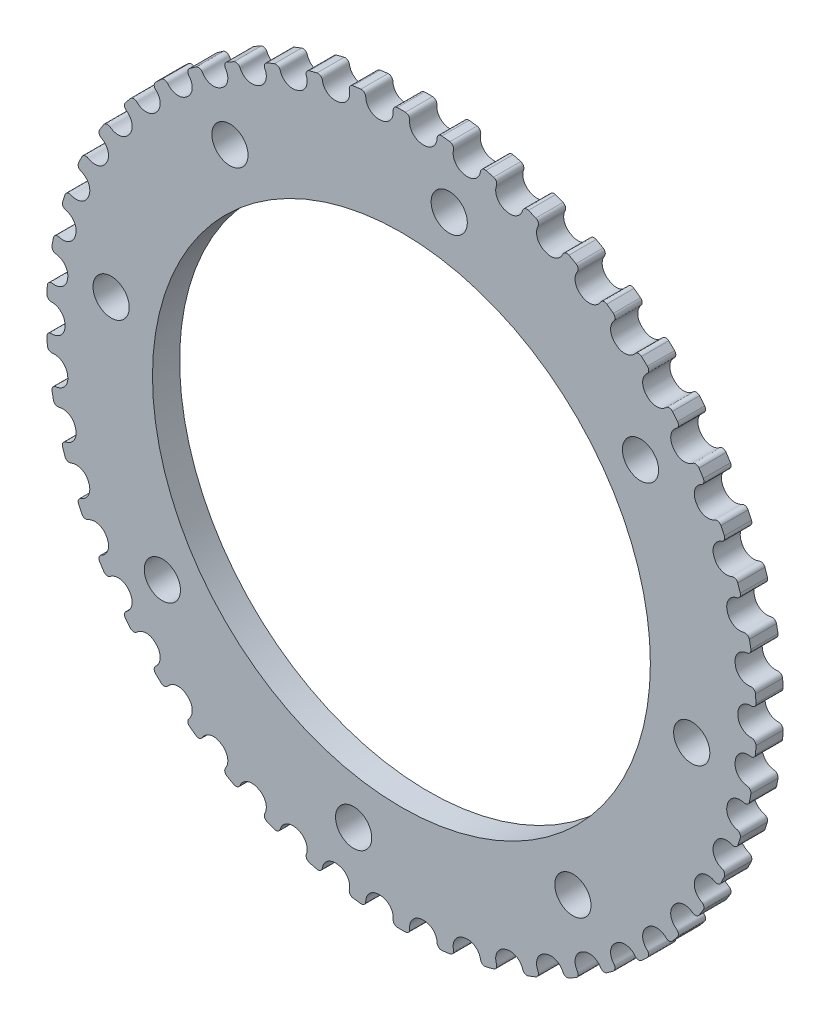
from build123d import *

# Parameters (mm, degrees)
SKETCHREVOLVEGEARBELT01_W       = 3
SKETCHREVOLVEGEARBELT01_H       = 39.217218411
TOOTHEXTRUDECUTGEARBELT01_DEPTH = 7.238999891
PATTERNGEARBELT01_COUNT         = 50
BOREREVOLVESKETCH_W             = 14.477999782
BOREREVOLVESKETCH_H             = 27.5
SKETCH1_R                       = 2
CUT_EXTRUDE1_DEPTH              = 10


with BuildPart() as part:
    # SketchRevolveGearBelt01 → GearBelt01 (revolve)
    with BuildSketch(Plane(origin=(0, 0, 0), x_dir=(0, 0, -1), z_dir=(1, 0, 0))):
        with Locations((0, 19.608609206)):
            Rectangle(SKETCHREVOLVEGEARBELT01_W, SKETCHREVOLVEGEARBELT01_H)
    revolve(axis=Axis((0, 0, 0), (0, 0, -1)))

    # SketchToothGearBelt01 → ToothExtrudeCutGearBelt01 (cut, symmetric)
    with BuildSketch(Plane.XY):
        with BuildLine():
            ThreePointArc((39.164679022, 2.032334243), (39.217374535, 0), (39.164679022, -2.032334243))
            add(Edge.make_bspline(
                [(39.164679022, -2.032334243), (39.166048883, -2.005984565), (39.164883295, -1.966294001), (39.156943231, -1.91408071), (39.147835553, -1.875531869), (39.135634795, -1.83784758), (39.12042125, -1.801275572), (39.102294908, -1.766056265), (39.081374934, -1.732421187), (39.057798852, -1.700591449), (39.031721649, -1.670776298), (39.003314752, -1.64317173), (38.972764904, -1.617959231), (38.940272938, -1.59530448), (38.906052449, -1.575356646), (38.870328405, -1.558245974), (38.833335623, -1.544088262), (38.795317397, -1.532964211), (38.756523252, -1.524993116), (38.717209712, -1.520055082), (38.66580266, -1.5184582), (38.589994052, -1.519756698), (38.489697952, -1.516042965), (38.377509936, -1.502613699), (38.266707897, -1.480535762), (38.157982142, -1.449806634), (38.052000418, -1.410652745), (37.949416183, -1.363305357), (37.850861265, -1.308058822), (37.756942857, -1.245252774), (37.668239537, -1.175274325), (37.585297771, -1.098554529), (37.50862852, -1.015566038), (37.43870413, -0.926820101), (37.375955295, -0.832863447), (37.320768875, -0.73427489), (37.27348376, -0.631661826), (37.234395318, -0.525656278), (37.203729181, -0.416911781), (37.181730901, -0.306096466), (37.168324647, -0.193899714), (37.165224472, -0.105119728), (37.165512565, -0.040500395), (37.16545238, 0), (37.165512565, 0.040500395), (37.165224472, 0.105119728), (37.168324647, 0.193899714), (37.181730901, 0.306096466), (37.203729181, 0.416911781), (37.234395318, 0.525656278), (37.27348376, 0.631661826), (37.320768875, 0.73427489), (37.375955295, 0.832863447), (37.43870413, 0.926820101), (37.50862852, 1.015566038), (37.585297771, 1.098554529), (37.668239537, 1.175274325), (37.756942857, 1.245252774), (37.850861265, 1.308058822), (37.949416183, 1.363305357), (38.052000418, 1.410652745), (38.157982142, 1.449806634), (38.266707897, 1.480535762), (38.377509936, 1.502613699), (38.489697952, 1.516042965), (38.589994052, 1.519756698), (38.66580266, 1.5184582), (38.717209712, 1.520055082), (38.756523252, 1.524993116), (38.795317397, 1.532964211), (38.833335623, 1.544088262), (38.870328405, 1.558245974), (38.906052449, 1.575356646), (38.940272938, 1.59530448), (38.972764904, 1.617959231), (39.003314752, 1.64317173), (39.031721649, 1.670776298), (39.057798852, 1.700591449), (39.081374934, 1.732421187), (39.102294908, 1.766056265), (39.12042125, 1.801275572), (39.135634795, 1.83784758), (39.147835553, 1.875531869), (39.156943231, 1.91408071), (39.164883295, 1.966294001), (39.166048883, 2.005984565), (39.164679022, 2.032334243)],
                knots=[0, 0, 0, 0, 0.012346399, 0.018519598, 0.024692797, 0.030865997, 0.037039196, 0.043212395, 0.049385595, 0.055558794, 0.061731993, 0.067905193, 0.074078392, 0.080251591, 0.086424791, 0.09259799, 0.09877119, 0.104944389, 0.111117588, 0.117290788, 0.123463987, 0.135171051, 0.152780618, 0.170390185, 0.187999752, 0.205609319, 0.223218886, 0.240828453, 0.25843802, 0.276047587, 0.293657154, 0.311266721, 0.328876288, 0.346485855, 0.364095422, 0.381704989, 0.399314555, 0.416924122, 0.434533689, 0.452143256, 0.469752823, 0.48736239, 0.493681195, 0.5, 0.506318805, 0.51263761, 0.530247177, 0.547856744, 0.565466311, 0.583075878, 0.600685445, 0.618295011, 0.635904578, 0.653514145, 0.671123712, 0.688733279, 0.706342846, 0.723952413, 0.74156198, 0.759171547, 0.776781114, 0.794390681, 0.812000248, 0.829609815, 0.847219382, 0.864828949, 0.876536013, 0.882709212, 0.888882412, 0.895055611, 0.90122881, 0.90740201, 0.913575209, 0.919748409, 0.925921608, 0.932094807, 0.938268007, 0.944441206, 0.950614405, 0.956787605, 0.962960804, 0.969134003, 0.975307203, 0.981480402, 0.987653601, 1, 1, 1, 1], degree=3))
        make_face()
    toothextrudecutgearbelt01 = extrude(amount=TOOTHEXTRUDECUTGEARBELT01_DEPTH, both=True, mode=Mode.SUBTRACT)

    # PatternGearBelt01: ToothExtrudeCutGearBelt01 ×50 about axis
    patterngearbelt01_axis = Axis((0, 0, 55), (0, 0, -1))
    for i in range(1, PATTERNGEARBELT01_COUNT):
        add(toothextrudecutgearbelt01.rotate(patterngearbelt01_axis, i * 360 / PATTERNGEARBELT01_COUNT), mode=Mode.SUBTRACT)

    # BoreRevolveSketch → BoreRevolveCut (revolve, cut)
    with BuildSketch(Plane(origin=(0, 0, 0), x_dir=(0, 0, -1), z_dir=(1, 0, 0))):
        with Locations((0, 13.75)):
            Rectangle(BOREREVOLVESKETCH_W, BOREREVOLVESKETCH_H)
    revolve(axis=Axis((0, 0, 0), (0, 0, -1)), mode=Mode.SUBTRACT)

    # Sketch1 → Cut-Extrude1 (cut)
    with BuildSketch(Plane.XY.offset(1.5)):
        with Locations((-26.408444856, -18.943179255)):
            Circle(SKETCH1_R)
        with Locations((-5.27873993, -32.068440947)):
            Circle(SKETCH1_R)
        with Locations((18.943179255, -26.408444856)):
            Circle(SKETCH1_R)
        with Locations((32.068440947, -5.27873993)):
            Circle(SKETCH1_R)
        with Locations((26.408444856, 18.943179255)):
            Circle(SKETCH1_R)
        with Locations((5.27873993, 32.068440947)):
            Circle(SKETCH1_R)
        with Locations((-18.943179255, 26.408444856)):
            Circle(SKETCH1_R)
        with Locations((-32.068440947, 5.27873993)):
            Circle(SKETCH1_R)
    extrude(amount=-CUT_EXTRUDE1_DEPTH, mode=Mode.SUBTRACT)


solid = part.part
